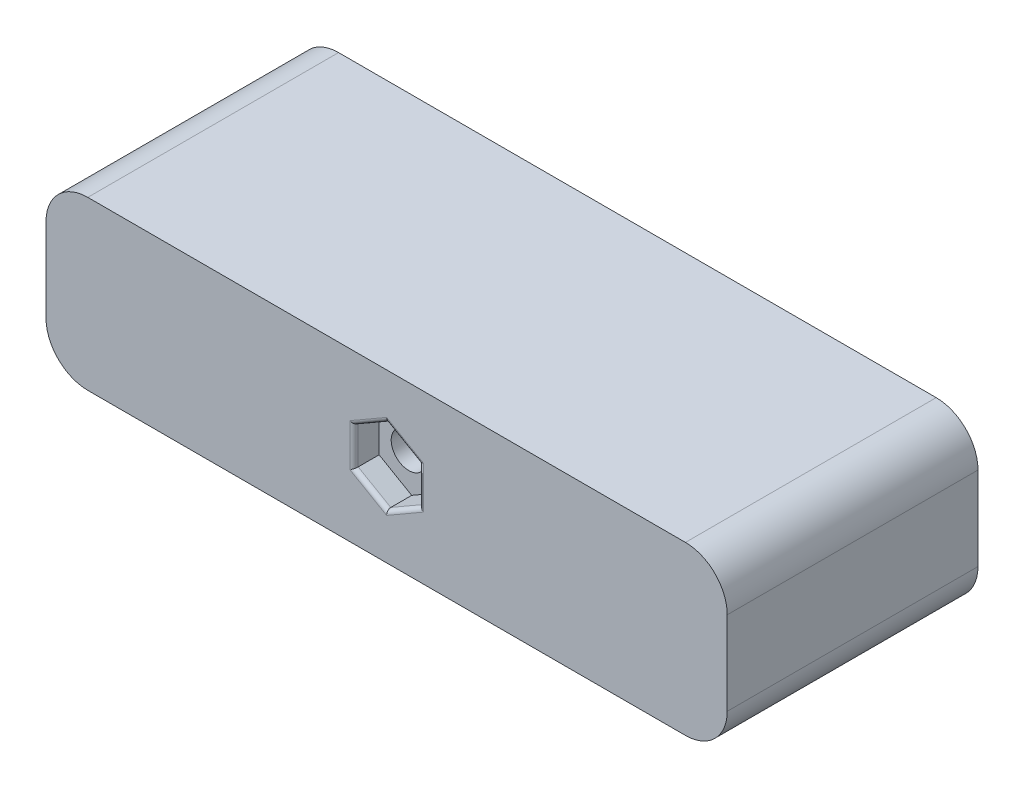
from build123d import *

# Parameters (mm, degrees)
ESQUISSE1_W             = 81.5
ESQUISSE1_H             = 20
BOSS_EXTRU_1_DEPTH      = 30
ENL_V_MAT_EXTRU_1_DEPTH = 3
CONG_1_R                = 5
CONG_2_R                = 0.5
ESQUISSE8_R             = 2.103774153
ENL_V_MAT_EXTRU_3_DEPTH = 90.119302062


with BuildPart() as part:
    # Esquisse1 → Boss.-Extru.1 (new body)
    with BuildSketch(Plane.XY):
        with Locations((-40.75, 10)):
            Rectangle(ESQUISSE1_W, ESQUISSE1_H)
    extrude(amount=BOSS_EXTRU_1_DEPTH)

    # Esquisse2 → Enlèv. mat.-Extru.1 (cut)
    with BuildSketch(Plane.XY.offset(30)):
        Polygon((-40.75, 5.4966679), (-36.85, 7.74833395), (-36.85, 12.25166605), (-40.75, 14.5033321), (-44.65, 12.25166605), (-44.65, 7.74833395), align=None)
    extrude(amount=-ENL_V_MAT_EXTRU_1_DEPTH, mode=Mode.SUBTRACT)

    # Congé1
    cong_1_edges = [part.edges().sort_by_distance(p)[0] for p in [
        (-81.5, 0, 15),
        (-81.5, 20, 15),
        (0, 0, 15),
        (0, 20, 15),
    ]]
    fillet(cong_1_edges, radius=CONG_1_R)

    # Congé2
    cong_2_edges = [part.edges().sort_by_distance(p)[0] for p in [
        (-44.65, 10, 30),
        (-42.7, 6.622500925, 30),
        (-38.8, 6.622500925, 30),
        (-36.85, 10, 30),
        (-38.8, 13.377499075, 30),
        (-42.7, 13.377499075, 30),
    ]]
    fillet(cong_2_edges, radius=CONG_2_R)

    # Esquisse8 → Enlèv. mat.-Extru.3 (cut, through all)
    with BuildSketch(Plane.XY):
        with Locations((-41.1, 10)):
            Circle(ESQUISSE8_R)
    extrude(amount=ENL_V_MAT_EXTRU_3_DEPTH, mode=Mode.SUBTRACT)


solid = part.part
